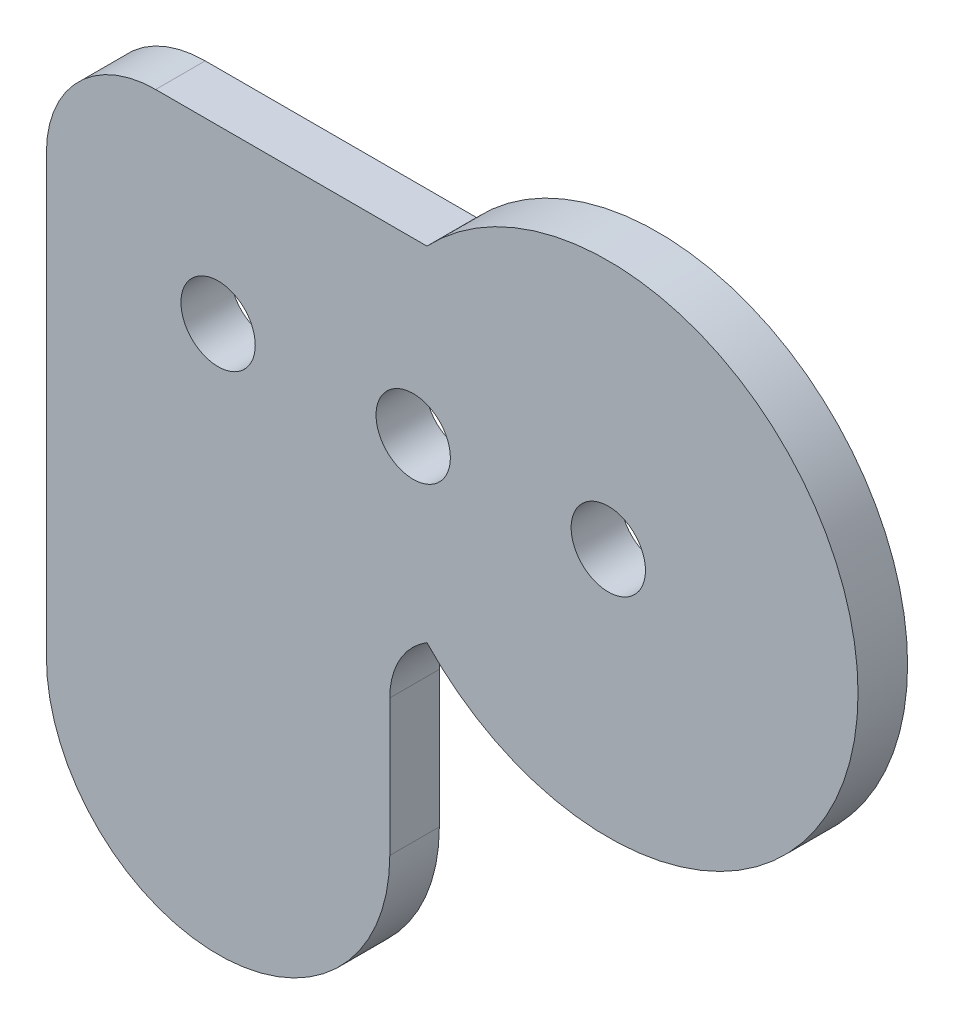
from build123d import *

# Parameters (mm, degrees)
BOSS_EXTRUDE1_DEPTH = 3.175
FILLET1_R           = 7
FILLET2_R           = 5
SKETCH2_R           = 2.38125
CUT_EXTRUDE1_DEPTH  = 51.309846203
LPATTERN1_COUNT     = 3
LPATTERN1_PITCH     = 12.5


with BuildPart() as part:
    # Sketch1 → Boss-Extrude1 (new body)
    with BuildSketch(Plane.XY):
        with BuildLine():
            Line((-11.618950039, 11), (-36, 11))
            Line((-36, 11), (-36, -24))
            ThreePointArc((-36, -24), (-25, -35), (-14, -24))
            Line((-14, -24), (-14, -11))
            Line((-14, -11), (-11.618950039, -11))
            ThreePointArc((-11.618950039, -11), (16, 0), (-11.618950039, 11))
        make_face()
    extrude(amount=BOSS_EXTRUDE1_DEPTH)

    # Fillet1
    fillet1_edges = [part.edges().sort_by_distance(p)[0] for p in [
        (-36, 11, 1.5875),
    ]]
    fillet(fillet1_edges, radius=FILLET1_R)

    # Fillet2
    # the kernel refuses this fillet: 5 mm, written as the material it adds along each edge
    with BuildSketch(Plane(origin=(-14, -11, 0), x_dir=(1, 0, 0), z_dir=(0, 0, 1))) as fillet2_piece_1:
        with BuildLine():
            CenterArc((5, -4.259237102), FILLET2_R, 121.586822832, 58.413177168)
            Line((0, -4.259237102), (-0.1, -4.259237102))
            Line((-0.1, -4.259237102), (-0.1, 0))
            Line((-0.1, 0), (0, 0.1))
            ThreePointArc((0, 0.1), (1.190524981, 0.1), (2.328670961, 0.085184742))
            Line((2.328670961, 0.085184742), (2.381049961, 0))
        make_face()
    extrude(amount=3.175)

    # Sketch2 → Cut-Extrude1 (cut, through all)
    with BuildSketch(Plane.XY.offset(3.175)):
        Circle(SKETCH2_R)
    cut_extrude1 = extrude(amount=-CUT_EXTRUDE1_DEPTH, mode=Mode.SUBTRACT)

    # LPattern1: Cut-Extrude1 ×3
    with Locations(*[(-i * LPATTERN1_PITCH, 0, 0) for i in range(1, LPATTERN1_COUNT)]):
        add(cut_extrude1, mode=Mode.SUBTRACT)


solid = part.part
